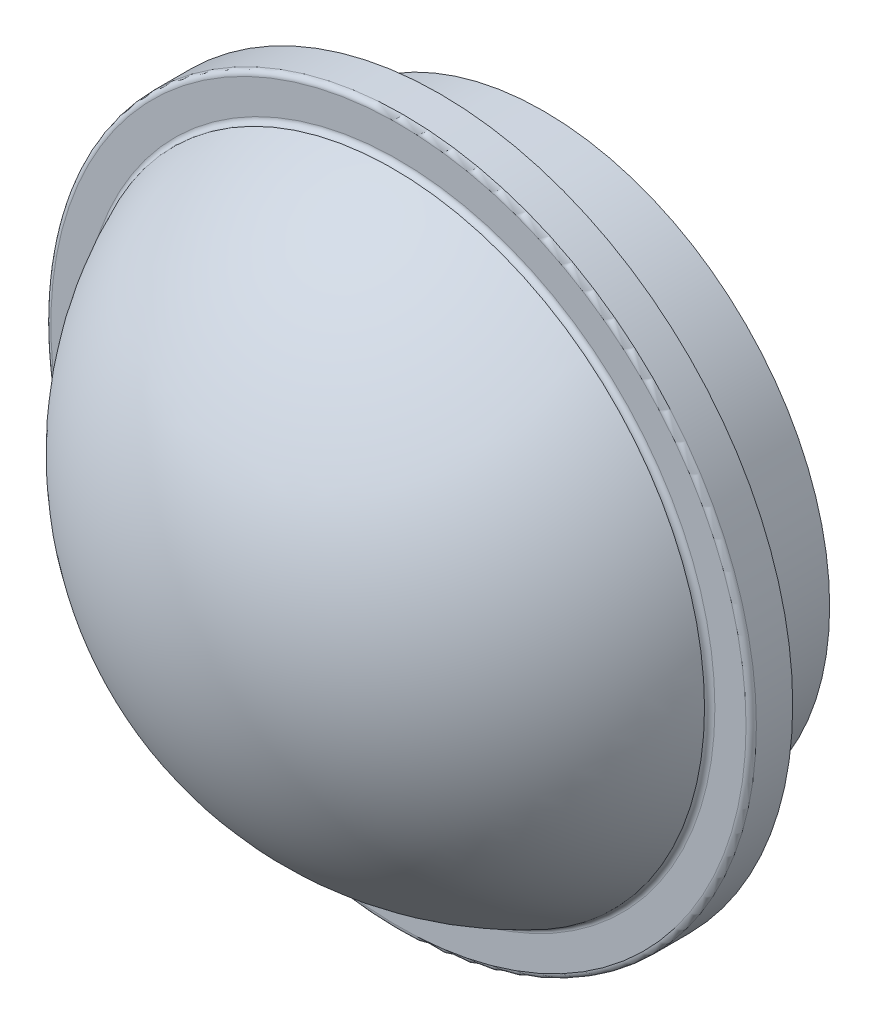
from build123d import *

# Parameters (mm, degrees)
ESQUISSE1_R        = 17
BOSS_EXTRU_1_DEPTH = 2
ESQUISSE2_R        = 13.78
ESQUISSE2_R_2      = 11
BOSS_EXTRU_2_DEPTH = 5
ESQUISSE3_R        = 15
BOSS_EXTRU_3_DEPTH = 0.25
D_ME1_FACE_RADIUS  = 15
D_ME1_HEIGHT       = 10
D_ME2_FACE_RADIUS  = 11
D_ME2_HEIGHT       = 11
CONG_1_R           = 0.25


with BuildPart() as part:
    # Esquisse1 → Boss.-Extru.1 (new body)
    with BuildSketch(Plane.XY):
        Circle(ESQUISSE1_R)
    extrude(amount=BOSS_EXTRU_1_DEPTH)

    # Esquisse2 → Boss.-Extru.2 (add)
    with BuildSketch(Plane(origin=(0, 0, 0), x_dir=(-1, 0, 0), z_dir=(0, 0, -1))):
        with Locations(Location((0, 0, 0), (0, 0, 180))):
            Circle(ESQUISSE2_R)
        Circle(ESQUISSE2_R_2, mode=Mode.SUBTRACT)
    extrude(amount=BOSS_EXTRU_2_DEPTH)

    # Esquisse3 → Boss.-Extru.3 (add)
    with BuildSketch(Plane.XY.offset(2)):
        Circle(ESQUISSE3_R)
    extrude(amount=BOSS_EXTRU_3_DEPTH)

    # Dôme1: a dome of height H over a round flat face of radius A is a cap of a sphere of radius (A * A + H * H) / (2 * H)
    d_me1_r = (D_ME1_FACE_RADIUS * D_ME1_FACE_RADIUS + D_ME1_HEIGHT * D_ME1_HEIGHT) / (2 * D_ME1_HEIGHT)
    d_me1_base = Plane((0, 0, 2.25), z_dir=(0, 0, 1))
    with Locations(d_me1_base.offset(D_ME1_HEIGHT - d_me1_r)):
        d_me1_ball = Sphere(d_me1_r, mode=Mode.PRIVATE)
    add(split(d_me1_ball, bisect_by=d_me1_base, keep=Keep.TOP, mode=Mode.PRIVATE))

    # Dôme2: a dome of height H over a round flat face of radius A is a cap of a sphere of radius (A * A + H * H) / (2 * H)
    d_me2_r = (D_ME2_FACE_RADIUS * D_ME2_FACE_RADIUS + D_ME2_HEIGHT * D_ME2_HEIGHT) / (2 * D_ME2_HEIGHT)
    d_me2_base = Plane((0, 0, 0), z_dir=(0, 0, 1))
    with Locations(d_me2_base.offset(D_ME2_HEIGHT - d_me2_r)):
        d_me2_ball = Sphere(d_me2_r, mode=Mode.PRIVATE)
    add(split(d_me2_ball, bisect_by=d_me2_base, keep=Keep.TOP, mode=Mode.PRIVATE), mode=Mode.SUBTRACT)

    # Congé1
    cong_1_edges = [part.edges().sort_by_distance(p)[0] for p in [
        (-15, 0, 2),
        (-17, 0, 2),
    ]]
    fillet(cong_1_edges, radius=CONG_1_R - 0.0001)  # a hair under: the kernel refuses the full size


solid = part.part
